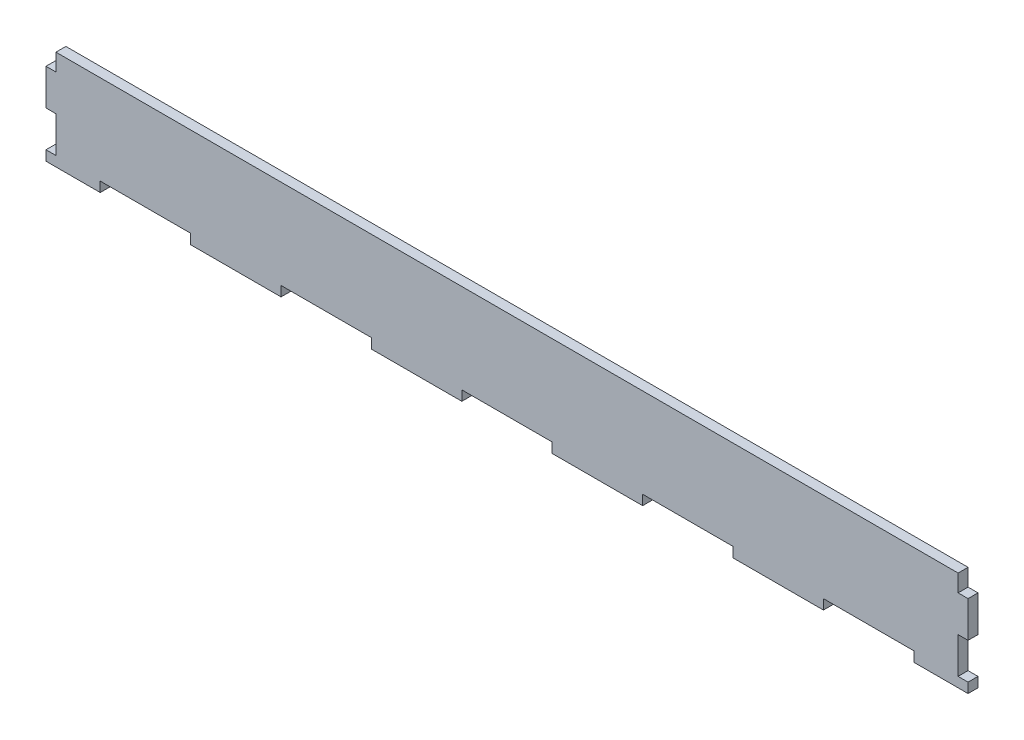
from build123d import *

# Parameters (mm, degrees)
SKETCH_1_W          = 510
SKETCH_1_H          = 55
EXTRUDE_1_DEPTH     = 5.5
SKETCH_2_W          = 50
SKETCH_2_H          = 5.5
CUT_EXTRUDE_1_DEPTH = 257.537521622
SKETCH_3_W          = 5.5
SKETCH_3_H          = 20
CUT_EXTRUDE_2_DEPTH = 257.537521622


with BuildPart() as part:
    # ｽｹｯﾁ1 → ﾎﾞｽ - 押し出し1 (new body)
    with BuildSketch(Plane.XY):
        Rectangle(SKETCH_1_W, SKETCH_1_H)
    extrude(amount=EXTRUDE_1_DEPTH)

    # ｽｹｯﾁ2 → ｶｯﾄ - 押し出し1 (cut, through all)
    with BuildSketch(Plane.XY.offset(5.5)):
        with Locations((0, -24.75)):
            Rectangle(SKETCH_2_W, SKETCH_2_H)
        with Locations((-100, -24.75)):
            Rectangle(SKETCH_2_W, SKETCH_2_H)
        with Locations((100, -24.75)):
            Rectangle(SKETCH_2_W, SKETCH_2_H)
        with Locations((200, -24.75)):
            Rectangle(SKETCH_2_W, SKETCH_2_H)
        with Locations((-200, -24.75)):
            Rectangle(SKETCH_2_W, SKETCH_2_H)
    extrude(amount=-CUT_EXTRUDE_1_DEPTH, mode=Mode.SUBTRACT)

    # ｽｹｯﾁ3 → ｶｯﾄ - 押し出し2 (cut, through all)
    with BuildSketch(Plane.XY.offset(5.5)):
        with Locations((252.25, -12)):
            Rectangle(SKETCH_3_W, SKETCH_3_H)
        with Locations((252.25, 28)):
            Rectangle(SKETCH_3_W, SKETCH_3_H)
        with Locations((-252.25, 28)):
            Rectangle(SKETCH_3_W, SKETCH_3_H)
        with Locations((-252.25, -12)):
            Rectangle(SKETCH_3_W, SKETCH_3_H)
    extrude(amount=-CUT_EXTRUDE_2_DEPTH, mode=Mode.SUBTRACT)


solid = part.part
